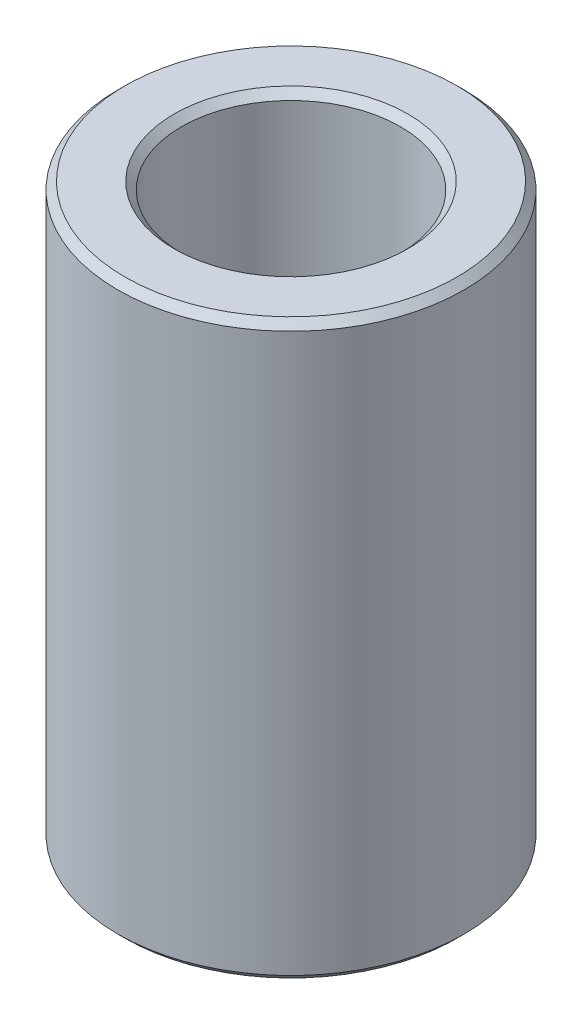
from build123d import *

# Parameters (mm, degrees)
SKETCH1_R           = 37.5
BOSS_EXTRUDE1_DEPTH = 123.970160326
SKETCH2_R           = 23.70570481
CUT_EXTRUDE1_DEPTH  = 135.837311792
CHAMFER1_SIZE       = 1.594191461


with BuildPart() as part:
    # Sketch1 → Boss-Extrude1 (new body)
    with BuildSketch(Plane(origin=(0, 0, 0), x_dir=(1, 0, 0), z_dir=(0, 1, 0))):
        Circle(SKETCH1_R)
    extrude(amount=BOSS_EXTRUDE1_DEPTH)

    # Sketch2 → Cut-Extrude1 (cut, through all)
    with BuildSketch(Plane(origin=(0, 0, 0), x_dir=(1, 0, 0), z_dir=(0, 1, 0))):
        Circle(SKETCH2_R)
    extrude(amount=CUT_EXTRUDE1_DEPTH, mode=Mode.SUBTRACT)

    # Chamfer1
    chamfer1_edges = [part.edges().sort_by_distance(p)[0] for p in [
        (-23.70570481, 123.970160326, 0),
        (-23.70570481, 0, 0),
        (-37.5, 0, 0),
        (-37.5, 123.970160326, 0),
    ]]
    chamfer(chamfer1_edges, length=CHAMFER1_SIZE)


solid = part.part
